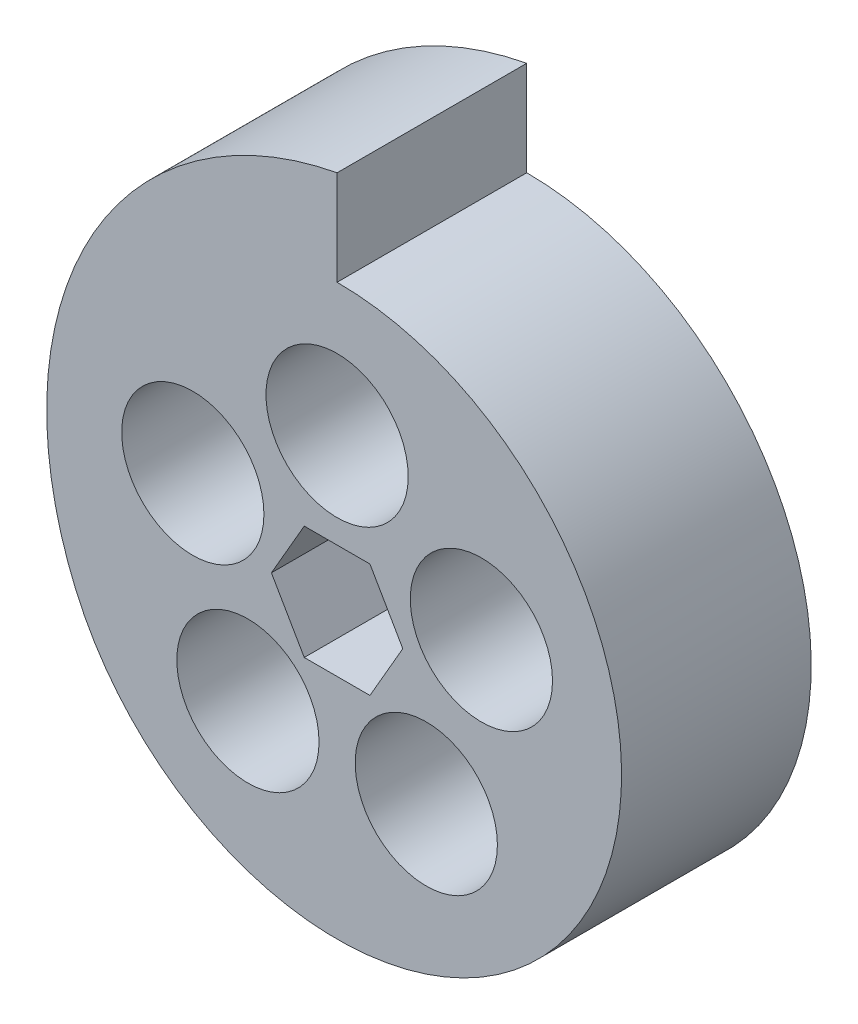
from build123d import *

# Parameters (mm, degrees)
SKETCH3_R           = 7.5
BOSS_EXTRUDE1_DEPTH = 20


with BuildPart() as part:
    # Sketch3 → Boss-Extrude1 (new body)
    with BuildSketch(Plane.XY):
        with BuildLine():
            Line((0, 30), (0, 40))
            ThreePointArc((0, 40), (-26.226618707, 20.675980746), (-27.550099413, -11.874006163))
            ThreePointArc((-27.550099413, -11.874006163), (25.062124659, -16.489084497), (0, 30))
        make_face()
        with Locations((0, 16)):
            Circle(SKETCH3_R, mode=Mode.SUBTRACT)
        with Locations((15.216904261, 4.94427191)):
            Circle(SKETCH3_R, mode=Mode.SUBTRACT)
        with Locations((9.404564037, -12.94427191)):
            Circle(SKETCH3_R, mode=Mode.SUBTRACT)
        with Locations((-9.404564037, -12.94427191)):
            Circle(SKETCH3_R, mode=Mode.SUBTRACT)
        with Locations((-15.216904261, 4.94427191)):
            Circle(SKETCH3_R, mode=Mode.SUBTRACT)
        Polygon((6.92820323, 0), (3.464101615, 6), (-3.464101615, 6), (-6.92820323, 0), (-3.464101615, -6), (3.464101615, -6), align=None, mode=Mode.SUBTRACT)
    extrude(amount=BOSS_EXTRUDE1_DEPTH)


solid = part.part
